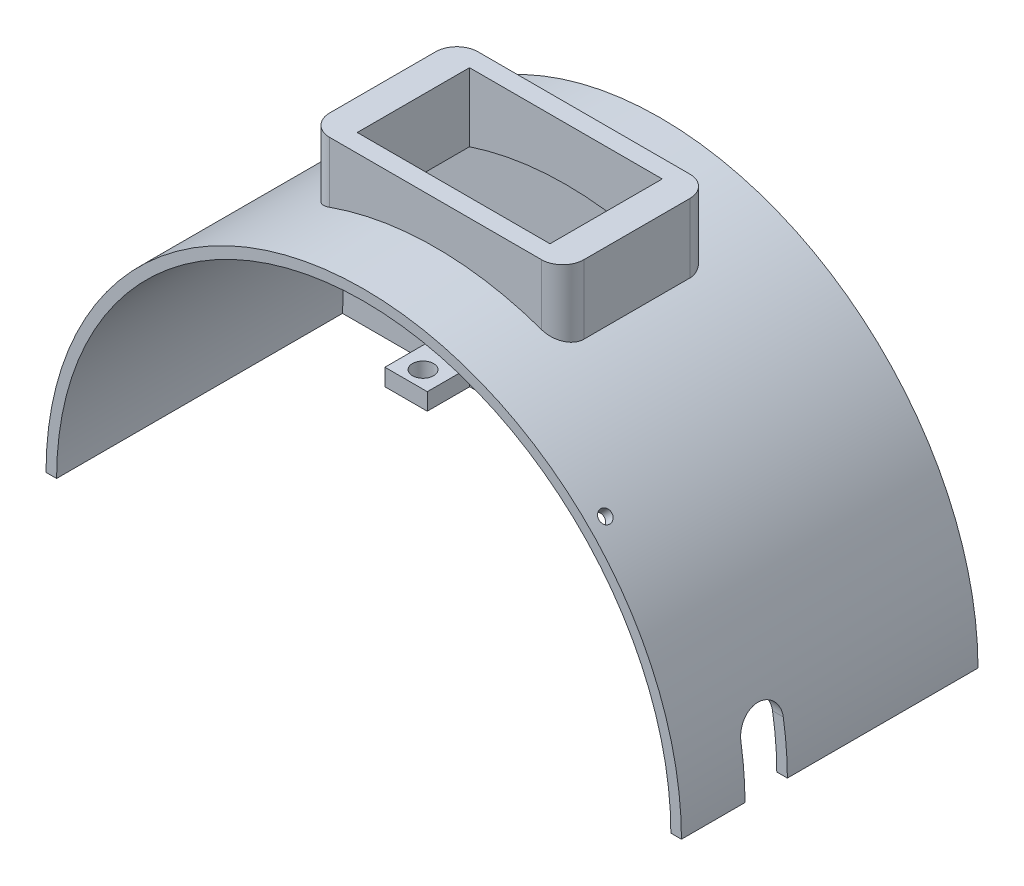
from build123d import *

# Parameters (mm, degrees)
SZKIC1_R                         = 75
DODANIE_WYCI_GNI_CIE1_DEPTH      = 70
SKORUPA1_T                       = -2.5
SZKIC3_W                         = 13
SZKIC3_H                         = 21
WYTNIJ_WYCI_GNI_CIE1_DEPTH       = 60
SZKIC4_W                         = 9
SZKIC4_H                         = 11
WYTNIJ_WYCI_GNI_CIE2_DEPTH       = 60
DODANIE_WYCI_GNI_CIE2_REACH      = 192.066
DODANIE_WYCI_GNI_CIE2_END_RADIUS = 75
SZKIC7_W                         = 60
SZKIC7_H                         = 35
SZKIC8_W                         = 45.5
SZKIC8_H                         = 26.5
WYTNIJ_WYCI_GNI_CIE4_DEPTH       = 30
ZAOKR_GLENIE1_R                  = 5
WYTNIJ_WYCI_GNI_CIE5_DEPTH       = 14
SZKIC10_R                        = 1.5
WYTNIJ_WYCI_GNI_CIE6_DEPTH       = 10
SZYK_KO_OWY1_COUNT               = 4
PRZECI_CIE1_START                = -75.0000001
PRZECI_CIE1_OUTLINE_W            = 152
PRZECI_CIE1_OUTLINE_H            = 70
PRZECI_CIE1_OUTLINE_W_2          = 13
PRZECI_CIE1_OUTLINE_H_2          = 21
PRZECI_CIE1_OUTLINE_W_3          = 9
PRZECI_CIE1_OUTLINE_H_3          = 11
PRZECI_CIE1_DEPTH                = 75.0000001
SZKIC11_W                        = 10
SZKIC11_H                        = 10
SZKIC11_R                        = 2.5
DODANIE_WYCI_GNI_CIE3_DEPTH      = 4


# Read off the part's stored shape, not the designer's step: Przecięcie1
with BuildPart() as part:
    # Szkic1 → Dodanie-wyciągnięcie1 (new body)
    with BuildSketch(Plane.XY):
        Circle(SZKIC1_R)
    extrude(amount=DODANIE_WYCI_GNI_CIE1_DEPTH)

    # Skorupa1
    skorupa1_openings = [part.faces().sort_by_distance(p)[0] for p in [
        (0, 0, 70),
    ]]
    offset(amount=SKORUPA1_T, openings=skorupa1_openings, kind=Kind.INTERSECTION)

    # Szkic3 → Wytnij-wyciągnięcie1 (cut)
    with BuildSketch(Plane(origin=(0, -75, 0), x_dir=(-1, 0, 0), z_dir=(0, -1, 0))):
        with Locations((0, -35)):
            Rectangle(SZKIC3_W, SZKIC3_H)
    extrude(amount=-WYTNIJ_WYCI_GNI_CIE1_DEPTH, mode=Mode.SUBTRACT)

    # Szkic4 → Wytnij-wyciągnięcie2 (cut)
    with BuildSketch(Plane(origin=(0, -75, 0), x_dir=(-1, 0, 0), z_dir=(0, -1, 0))):
        with Locations((0, -14)):
            Rectangle(SZKIC4_W, SZKIC4_H)
    extrude(amount=-WYTNIJ_WYCI_GNI_CIE2_DEPTH, mode=Mode.SUBTRACT)

    # Dodanie-wyciągnięcie2: up to this cylinder (the profile starts outside it)
    dodanie_wyci_gni_cie2_end = Plane(origin=(0, 0, 35.532003), z_dir=(0, 0, -1)) * Cylinder(DODANIE_WYCI_GNI_CIE2_END_RADIUS, 535.132, mode=Mode.PRIVATE)
    # Szkic7 → Dodanie-wyciągnięcie2 (add, up to the surface)
    with BuildSketch(Plane(origin=(0, 85, 0), x_dir=(-1, 0, 0), z_dir=(0, -1, 0)), mode=Mode.PRIVATE) as dodanie_wyci_gni_cie2_sk1:
        with Locations((0, -35.532003496)):
            Rectangle(SZKIC7_W, SZKIC7_H)
    dodanie_wyci_gni_cie2_tool1 = extrude(dodanie_wyci_gni_cie2_sk1.sketch, amount=DODANIE_WYCI_GNI_CIE2_REACH, mode=Mode.PRIVATE) - dodanie_wyci_gni_cie2_end
    add(dodanie_wyci_gni_cie2_tool1.solids().sort_by_distance((0, 85, 35.532003))[0])

    # Szkic8 → Wytnij-wyciągnięcie4 (cut)
    with BuildSketch(Plane(origin=(0, 85, 0), x_dir=(1, 0, 0), z_dir=(0, 1, 0))):
        with Locations((0, -35.532003496)):
            Rectangle(SZKIC8_W, SZKIC8_H)
    extrude(amount=-WYTNIJ_WYCI_GNI_CIE4_DEPTH, mode=Mode.SUBTRACT)

    # Zaokrąglenie1
    zaokr_glenie1_edges = [part.edges().sort_by_distance(p)[0] for p in [
        (-30, 76.869317712, 18.032003496),
        (-30, 76.869317712, 53.032003496),
        (30, 76.869317712, 18.032003496),
        (30, 76.869317712, 53.032003496),
    ]]
    fillet(zaokr_glenie1_edges, radius=ZAOKR_GLENIE1_R)

    # Szkic9 → Wytnij-wyciągnięcie5 (cut)
    with BuildSketch(Plane(origin=(75, 0, 0), x_dir=(0, 0, -1), z_dir=(1, 0, 0))):
        with BuildLine():
            Line((-55, -12.979686846), (-55, 12.020313154))
            ThreePointArc((-55, 12.020313154), (-50, 17.020313154), (-45, 12.020313154))
            Line((-45, 12.020313154), (-45, -12.979686846))
            ThreePointArc((-45, -12.979686846), (-50, -17.979686846), (-55, -12.979686846))
        make_face()
    extrude(amount=-WYTNIJ_WYCI_GNI_CIE5_DEPTH, mode=Mode.SUBTRACT)

    # Szkic10 → Wytnij-wyciągnięcie6 (cut)
    with BuildSketch(Plane(origin=(53.033008589, 53.033008589, 0), x_dir=(0, 0, -1), z_dir=(0.7071067811865512, 0.7071067811865438, 0))):
        with Locations(Location((-66, 0, 0), (0, 0, 90))):
            Circle(SZKIC10_R)
    wytnij_wyci_gni_cie6 = extrude(amount=-WYTNIJ_WYCI_GNI_CIE6_DEPTH, mode=Mode.SUBTRACT)

    # Szyk kołowy1: Wytnij-wyciągnięcie6 ×4 about axis
    szyk_ko_owy1_axis = Axis((0, 0, 70), (0, 0, -1))
    for i in range(1, SZYK_KO_OWY1_COUNT):
        add(wytnij_wyci_gni_cie6.rotate(szyk_ko_owy1_axis, i * 360 / SZYK_KO_OWY1_COUNT), mode=Mode.SUBTRACT)

    # Przecięcie1 outline → Przecięcie1 (cut)
    with BuildSketch(Plane(origin=(0, 0, 0), x_dir=(1, 0, 0), z_dir=(0, 1, 0)).offset(PRZECI_CIE1_START)):
        with Locations((0, -35)):
            Rectangle(PRZECI_CIE1_OUTLINE_W, PRZECI_CIE1_OUTLINE_H)
        with Locations((0, -35)):
            Rectangle(PRZECI_CIE1_OUTLINE_W_2, PRZECI_CIE1_OUTLINE_H_2, mode=Mode.SUBTRACT)
        with Locations((0, -14)):
            Rectangle(PRZECI_CIE1_OUTLINE_W_3, PRZECI_CIE1_OUTLINE_H_3, mode=Mode.SUBTRACT)
    extrude(amount=PRZECI_CIE1_DEPTH, mode=Mode.SUBTRACT)

    # Szkic11 → Dodanie-wyciągnięcie3 (add)
    # profile 1 of 2: a face of its own
    with BuildSketch(Plane(origin=(0, 0, 0), x_dir=(-1, 0, 0), z_dir=(0, -1, 0))):
        with Locations((47.5, -7.5)):
            Rectangle(SZKIC11_W, SZKIC11_H)
        with Locations(Location((47.5, -8.5, 0), (0, 0, 90))):
            Circle(SZKIC11_R, mode=Mode.SUBTRACT)
    # profile 2 of 2: a face of its own
    with BuildSketch(Plane(origin=(0, 0, 0), x_dir=(-1, 0, 0), z_dir=(0, -1, 0))):
        with Locations((-47.5, -7.5)):
            Rectangle(SZKIC11_W, SZKIC11_H)
        with Locations(Location((-47.5, -8.5, 0), (0, 0, 90))):
            Circle(SZKIC11_R, mode=Mode.SUBTRACT)
    extrude(amount=-DODANIE_WYCI_GNI_CIE3_DEPTH)


solid = part.part
